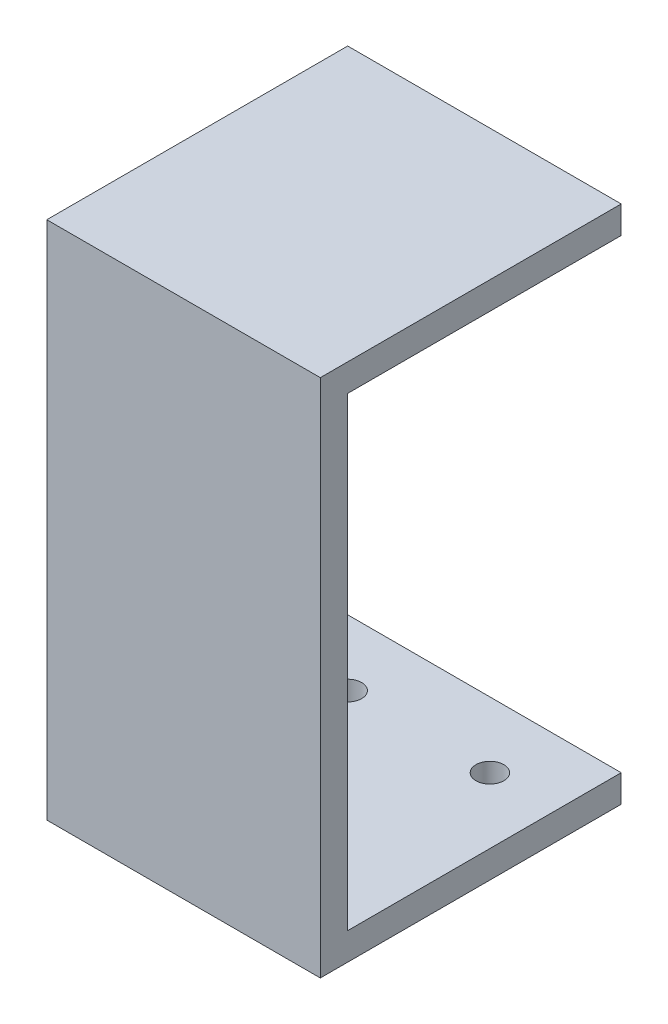
from build123d import *

# Parameters (mm, degrees)
SKETCH_1_W                     = 50
SKETCH_1_H                     = 95.04
EXTRUDE_1_DEPTH                = 5
SKETCH_2_W                     = 50
SKETCH_2_H                     = 5
EXTRUDE_2_DEPTH                = 50
HOLE_START                     = -47.52
HOLE_WIZARD_1_4_20_3_OUTLINE_R = 2.5527
HOLE_WIZARD_1_4_20_3_DEPTH     = 5


# Read off the part's stored shape, not the designer's step: 1/4-20 螺纹孔3
with BuildPart() as part:
    # 草图1 → 凸台-拉伸1 (new body)
    with BuildSketch(Plane.XY):
        Rectangle(SKETCH_1_W, SKETCH_1_H)
    extrude(amount=EXTRUDE_1_DEPTH)

    # 草图2 → 凸台-拉伸2 (add)
    with BuildSketch(Plane(origin=(0, 0, 0), x_dir=(-1, 0, 0), z_dir=(0, 0, -1))):
        with Locations((0, 45.02)):
            Rectangle(SKETCH_2_W, SKETCH_2_H)
        with Locations((0, -45.02)):
            Rectangle(SKETCH_2_W, SKETCH_2_H)
    extrude(amount=EXTRUDE_2_DEPTH)

    # 1/4-20 螺纹孔3 outline → 1/4-20 螺纹孔3 (cut)
    with BuildSketch(Plane(origin=(0, 0, 0), x_dir=(1, 0, 0), z_dir=(0, 1, 0)).offset(HOLE_START)):
        with Locations((13, 7)):
            Circle(HOLE_WIZARD_1_4_20_3_OUTLINE_R)
        with Locations((13, 38)):
            Circle(HOLE_WIZARD_1_4_20_3_OUTLINE_R)
        with Locations((-13, 38)):
            Circle(HOLE_WIZARD_1_4_20_3_OUTLINE_R)
        with Locations((-13, 7)):
            Circle(HOLE_WIZARD_1_4_20_3_OUTLINE_R)
    extrude(amount=HOLE_WIZARD_1_4_20_3_DEPTH, mode=Mode.SUBTRACT)


solid = part.part
